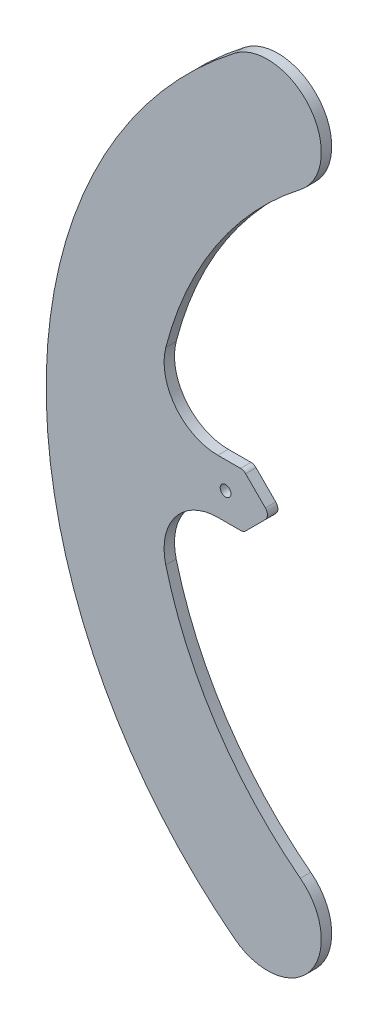
from build123d import *

# Parameters (mm, degrees)
SKETCH1_R           = 1.5
BOSS_EXTRUDE1_DEPTH = 2.9
FILLET1_R           = 15
FILLET2_R           = 2


with BuildPart() as part:
    # Sketch1 → Boss-Extrude1 (new body)
    with BuildSketch(Plane.XY):
        with BuildLine():
            ThreePointArc((-11.978690547, -106.87499991), (9.060608653, -104.164298748), (6.349906949, -83.124999619))
            ThreePointArc((6.349906949, -83.124999619), (-22.020584843, -49.648176002), (-34.231800328, -7.5))
            Line((-34.231800328, -7.5), (-9.5, -7.5))
            Line((-9.5, -7.5), (-2, 0))
            Line((-2, 0), (-9.5, 7.5))
            Line((-9.5, 7.5), (-34.231800328, 7.5))
            ThreePointArc((-34.231800328, 7.5), (-22.020584884, 49.648175925), (6.349906811, 83.124999512))
            ThreePointArc((6.349906811, 83.124999512), (9.060608694, 104.164298694), (-11.978690577, 106.874999887))
            ThreePointArc((-11.978690577, 106.874999887), (-64.5, -1.9e-08), (-11.978690547, -106.87499991))
        make_face()
        with Locations((-14.5, 0)):
            Circle(SKETCH1_R, mode=Mode.SUBTRACT)
    extrude(amount=BOSS_EXTRUDE1_DEPTH)

    # Fillet1
    fillet1_edges = [part.edges().sort_by_distance(p)[0] for p in [
        (-34.231800328, -7.5, 1.45),
        (-34.231800328, 7.5, 1.45),
    ]]
    fillet(fillet1_edges, radius=FILLET1_R)

    # Fillet2
    fillet2_edges = [part.edges().sort_by_distance(p)[0] for p in [
        (-9.5, -7.5, 1.45),
        (-9.5, 7.5, 1.45),
        (-2, 0, 1.45),
    ]]
    fillet(fillet2_edges, radius=FILLET2_R)


solid = part.part
